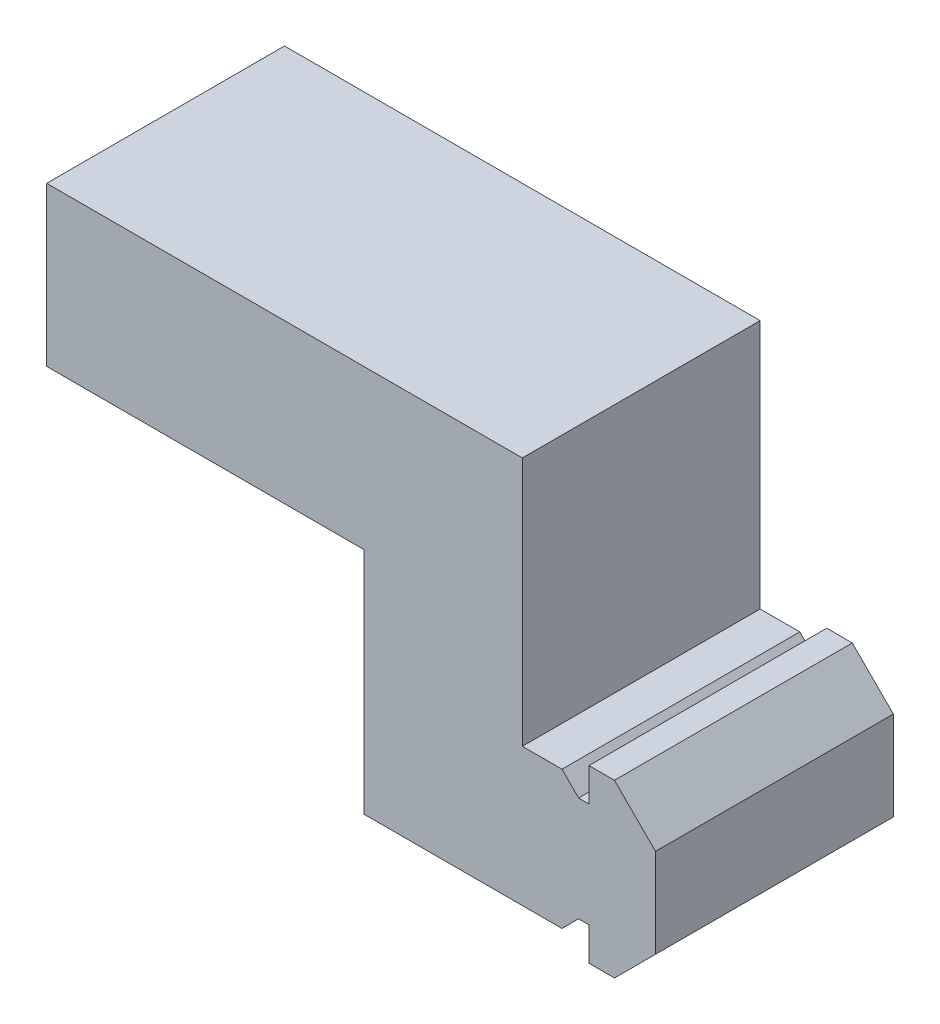
from build123d import *

# Parameters (mm, degrees)
BOSS_EXTRUDE1_DEPTH = 15
SKETCH2_W           = 15
SKETCH2_H           = 8.7
BOSS_EXTRUDE2_DEPTH = 12.5
SKETCH3_W           = 10
SKETCH3_H           = 15
BOSS_EXTRUDE3_DEPTH = 15.75
SKETCH5_W           = 15
SKETCH5_H           = 10
BOSS_EXTRUDE4_DEPTH = 20


with BuildPart() as part:
    # Sketch1 → Boss-Extrude1 (new body)
    with BuildSketch(Plane.XY):
        Polygon((-2.615803919, 7.044502111), (-3.665803919, 8.094502111), (-3.665803919, -0.605497889), (-2.615803919, 0.444502111), (-1.965803919, 0.444502111), (-1.965803919, -1.655497889), (-0.354656646, -1.655497889), (2.234196081, 0.933354838), (2.234196081, 6.555649384), (-0.354656646, 9.144502111), (-1.965803919, 9.144502111), (-1.965803919, 7.044502111), align=None)
    extrude(amount=BOSS_EXTRUDE1_DEPTH)

    # Sketch2 → Boss-Extrude2 (add)
    with BuildSketch(Plane.ZY.offset(3.665803919)):
        with Locations((7.5, 3.744502111)):
            Rectangle(SKETCH2_W, SKETCH2_H)
    extrude(amount=BOSS_EXTRUDE2_DEPTH)

    # Sketch3 → Boss-Extrude3 (add)
    with BuildSketch(Plane(origin=(0, 8.094502111, 0), x_dir=(1, 0, 0), z_dir=(0, 1, 0))):
        with Locations((-11.165803919, -7.5)):
            Rectangle(SKETCH3_W, SKETCH3_H)
    extrude(amount=BOSS_EXTRUDE3_DEPTH)

    # Sketch5 → Boss-Extrude4 (add)
    with BuildSketch(Plane.ZY.offset(16.165803919)):
        with Locations((7.5, 18.844502111)):
            Rectangle(SKETCH5_W, SKETCH5_H)
    extrude(amount=BOSS_EXTRUDE4_DEPTH)


solid = part.part
